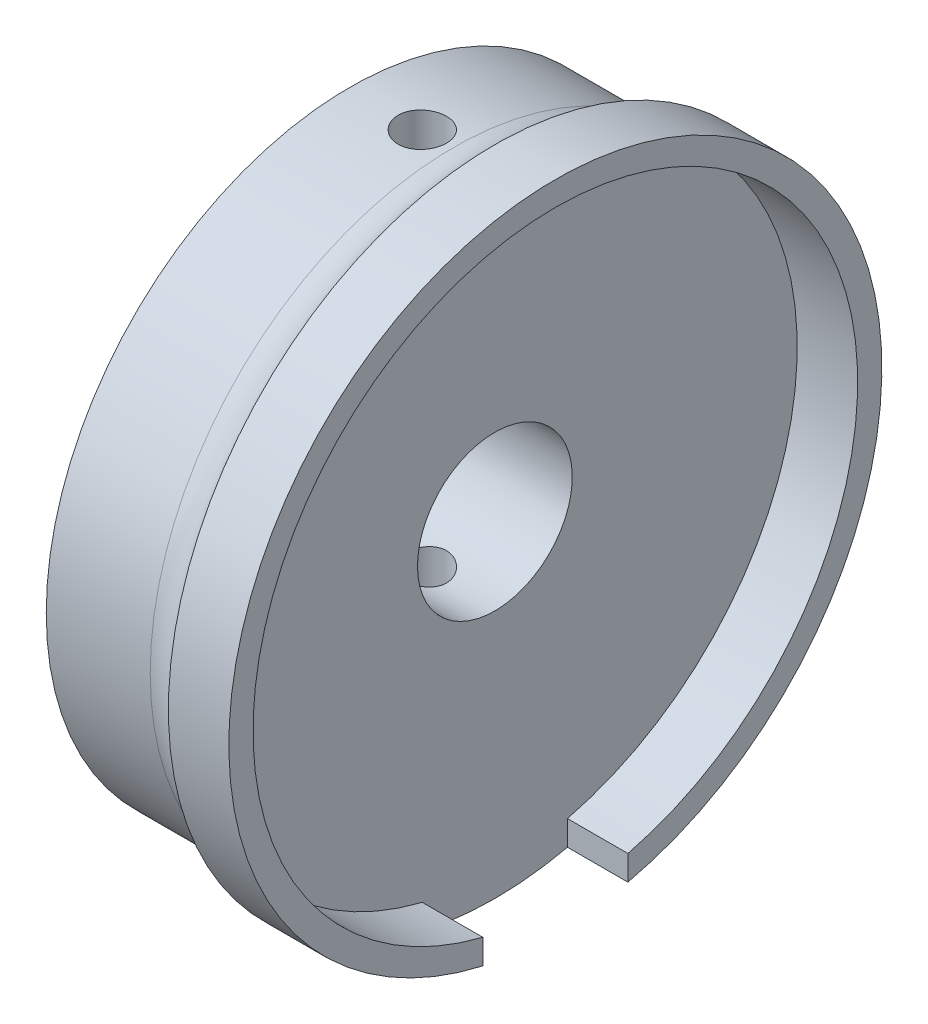
from build123d import *

# Parameters (mm, degrees)
SKETCH_1_R                      = 12.55
EXTRUDE_1_DEPTH                 = 6
SKETCH_2_R                      = 3.2
CUT_EXTRUDE_1_DEPTH             = 6
CUT_EXTRUDE_2_REACH             = 20.735
SKETCH_3_R                      = 1
CUT_EXTRUDE_2_DIRECTION_2_REACH = 20.735
SKETCH_4_R                      = 13.5
EXTRUDE_2_DEPTH                 = 2.5
SKETCH_5_R                      = 12.5
CUT_EXTRUDE_3_DEPTH             = 2.5
FILLET_2_R                      = 2
SKETCH_6_W                      = 2.5
SKETCH_6_H                      = 6
CUT_EXTRUDE_4_DEPTH             = 15


with BuildPart() as part:
    # 草图1 → 凸台-拉伸1 (new body)
    with BuildSketch(Plane(origin=(0, 0, 0), x_dir=(0, 0, -1), z_dir=(1, 0, 0))):
        Circle(SKETCH_1_R)
    extrude(amount=EXTRUDE_1_DEPTH)

    # 草图2 → 切除-拉伸1 (cut)
    with BuildSketch(Plane.ZY):
        Circle(SKETCH_2_R)
    extrude(amount=-CUT_EXTRUDE_1_DEPTH, mode=Mode.SUBTRACT)

    # 草图3 → 切除-拉伸2 (cut, up to next)
    with BuildSketch(Plane(origin=(0, 0, 0), x_dir=(1, 0, 0), z_dir=(0, 1, 0)), mode=Mode.PRIVATE) as cut_extrude_2_sk1:
        with Locations(Location((3, 0, 0), (0, 0, 270))):
            Circle(SKETCH_3_R)
    cut_extrude_2_tool1 = extrude(cut_extrude_2_sk1.sketch, amount=-CUT_EXTRUDE_2_REACH, mode=Mode.PRIVATE) & part.part
    add(cut_extrude_2_tool1.solids().sort_by_distance((3, 0, 0))[0], mode=Mode.SUBTRACT)

    # 草图3 → 切除-拉伸2 direction 2 (cut, up to next)
    with BuildSketch(Plane(origin=(0, 0, 0), x_dir=(1, 0, 0), z_dir=(0, 1, 0)), mode=Mode.PRIVATE) as cut_extrude_2_direction_2_sk1:
        with Locations(Location((3, 0, 0), (0, 0, 270))):
            Circle(SKETCH_3_R)
    cut_extrude_2_direction_2_tool1 = extrude(cut_extrude_2_direction_2_sk1.sketch, amount=CUT_EXTRUDE_2_DIRECTION_2_REACH, mode=Mode.PRIVATE) & part.part
    add(cut_extrude_2_direction_2_tool1.solids().sort_by_distance((3, 0, 0))[0], mode=Mode.SUBTRACT)

    # 草图4 → 凸台-拉伸2 (add)
    with BuildSketch(Plane(origin=(6, 0, 0), x_dir=(0, 0, -1), z_dir=(1, 0, 0))):
        Circle(SKETCH_4_R)
    extrude(amount=EXTRUDE_2_DEPTH)

    # 草图5 → 切除-拉伸3 (cut)
    with BuildSketch(Plane(origin=(8.5, 0, 0), x_dir=(0, 0, -1), z_dir=(1, 0, 0))):
        Circle(SKETCH_5_R)
    extrude(amount=-CUT_EXTRUDE_3_DEPTH, mode=Mode.SUBTRACT)

    # 圆角2
    # the kernel refuses this fillet: 2 mm, written as the material it adds along each edge
    with BuildSketch(Plane(origin=(6, 0, 0), x_dir=(0, 0, -1), z_dir=(0, -1, 0))) as fillet_2_piece_1:
        with BuildLine():
            CenterArc((14.55, -1.702204453), FILLET_2_R, 121.668243254, 58.331756746)
            Line((12.55, -1.702204453), (12.51, -1.702204453))
            Line((12.51, -1.702204453), (12.51, 0))
            Line((12.51, 0), (12.55, 0.04))
            ThreePointArc((12.55, 0.04), (13.025, 0.04), (13.479, 0.034044089))
            Line((13.479, 0.034044089), (13.5, 0))
        make_face()
    revolve(axis=Axis((6, 0, 0), (1, 0, 0)))

    # 草图6 → 切除-拉伸4 (cut)
    with BuildSketch(Plane(origin=(0, 0, 0), x_dir=(1, 0, 0), z_dir=(0, 1, 0))):
        with Locations((7.25, 0)):
            Rectangle(SKETCH_6_W, SKETCH_6_H)
    extrude(amount=-CUT_EXTRUDE_4_DEPTH, mode=Mode.SUBTRACT)


solid = part.part
